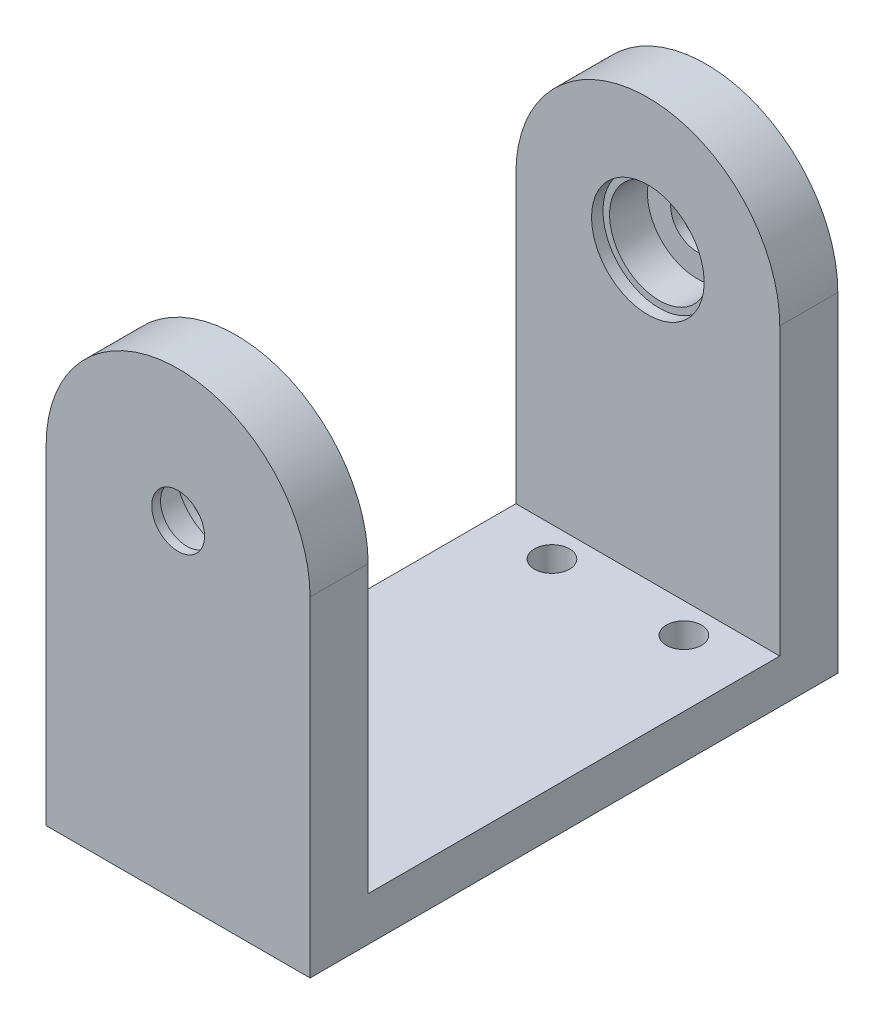
from build123d import *

# Parameters (mm, degrees)
SKETCH1_W           = 30
SKETCH1_H           = 60
SKETCH1_R           = 2
BOSS_EXTRUDE1_DEPTH = 5
SKETCH3_R           = 3
BOSS_EXTRUDE2_DEPTH = 6.6
SKETCH4_R           = 6.4
CUT_EXTRUDE1_DEPTH  = 1.3
SKETCH6_R           = 5.65
CUT_EXTRUDE2_DEPTH  = 4.3


with BuildPart() as part:
    # Sketch1 → Boss-Extrude1 (new body)
    with BuildSketch(Plane(origin=(0, 0, 0), x_dir=(1, 0, 0), z_dir=(0, 1, 0))):
        Rectangle(SKETCH1_W, SKETCH1_H)
        with Locations((-7.5, 20)):
            Circle(SKETCH1_R, mode=Mode.SUBTRACT)
        with Locations((7.5, 20)):
            Circle(SKETCH1_R, mode=Mode.SUBTRACT)
        with Locations((7.5, -20)):
            Circle(SKETCH1_R, mode=Mode.SUBTRACT)
        with Locations((-7.5, -20)):
            Circle(SKETCH1_R, mode=Mode.SUBTRACT)
    extrude(amount=BOSS_EXTRUDE1_DEPTH)

    # Sketch3 → Boss-Extrude2 (add)
    with BuildSketch(Plane.XY.offset(30)):
        with BuildLine():
            Line((-15, 5), (15, 5))
            Line((15, 5), (15, 37.5))
            ThreePointArc((15, 37.5), (0, 52.5), (-15, 37.5))
            Line((-15, 37.5), (-15, 5))
        make_face()
        with Locations((0, 37.5)):
            Circle(SKETCH3_R, mode=Mode.SUBTRACT)
    boss_extrude2 = extrude(amount=-BOSS_EXTRUDE2_DEPTH)

    # Sketch4 → Cut-Extrude1 (cut)
    with BuildSketch(Plane(origin=(0, 0, 23.4), x_dir=(-1, 0, 0), z_dir=(0, 0, -1))):
        with Locations((0, 37.5)):
            Circle(SKETCH4_R)
    cut_extrude1 = extrude(amount=-CUT_EXTRUDE1_DEPTH, mode=Mode.SUBTRACT)

    # Sketch6 → Cut-Extrude2 (cut)
    with BuildSketch(Plane(origin=(0, 0, 24.7), x_dir=(-1, 0, 0), z_dir=(0, 0, -1))):
        with Locations((0, 37.5)):
            Circle(SKETCH6_R)
    cut_extrude2 = extrude(amount=-CUT_EXTRUDE2_DEPTH, mode=Mode.SUBTRACT)

    # Mirror2: Boss-Extrude2, Cut-Extrude1, Cut-Extrude2 across plane
    add(boss_extrude2.mirror(Plane.XY))
    add(cut_extrude1.mirror(Plane.XY), mode=Mode.SUBTRACT)
    add(cut_extrude2.mirror(Plane.XY), mode=Mode.SUBTRACT)


solid = part.part
